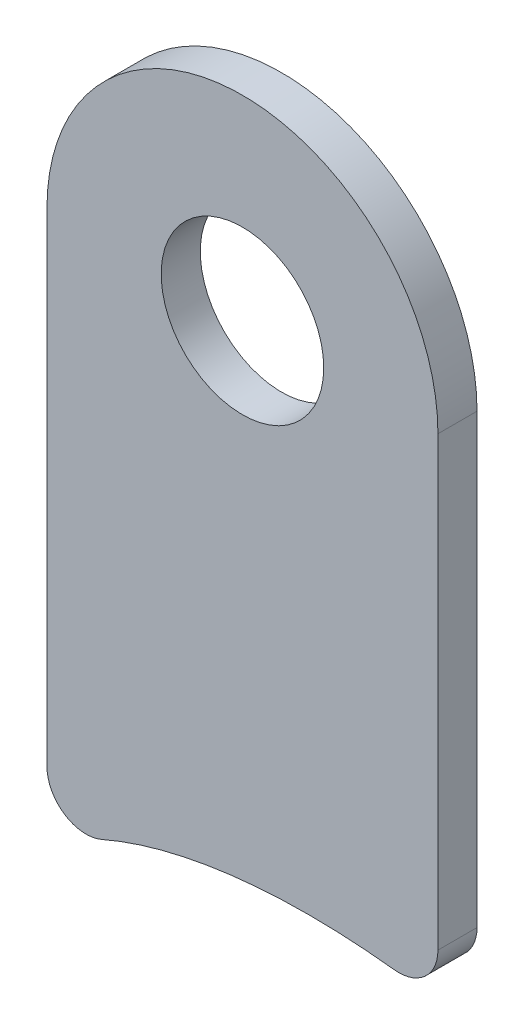
from build123d import *

# Parameters (mm, degrees)
BOSS_EXTRUDE1_DEPTH  = 1.5875
M6_CLEARANCE_HOLE1_D = 6.6
CUT_EXTRUDE3_DEPTH   = 30.699405508
FILLET2_R            = 1.5875


with BuildPart() as part:
    # Sketch1 → Boss-Extrude1 (new body)
    with BuildSketch(Plane.XY):
        with BuildLine():
            Line((7.9375, -28.575), (7.9375, 0))
            ThreePointArc((7.9375, 0), (0, 7.9375), (-7.9375, 0))
            Line((-7.9375, 0), (-7.9375, -28.575))
            Line((-7.9375, -28.575), (7.9375, -28.575))
        make_face()
    extrude(amount=BOSS_EXTRUDE1_DEPTH)

    # M6 Clearance Hole1 (through all)
    with Locations(Plane.XY.offset(1.5875)):
        with Locations((0, 0)):
            Hole(M6_CLEARANCE_HOLE1_D / 2)

    # Sketch6 → Cut-Extrude3 (cut, through all)
    with BuildSketch(Plane(origin=(0, 0, 0), x_dir=(-1, 0, 0), z_dir=(0, 0, -1))):
        with BuildLine():
            add(Edge.make_bspline(
                [(11.16362821, -26.486723611), (3.088420847, -2.404551241), (-38.374191438, -16.307748464), (-30.298984075, -40.389920834), (-22.223776712, -64.472093203), (19.238835573, -50.568895981), (11.16362821, -26.486723611)],
                knots=[0, 0, 0, 0, 0.5, 0.5, 0.5, 1, 1, 1, 1], degree=3, weights=[1, 0.333333333, 0.333333333, 1, 0.333333333, 0.333333333, 1]))
        make_face()
    extrude(amount=-CUT_EXTRUDE3_DEPTH, mode=Mode.SUBTRACT)

    # Fillet2
    fillet2_edges = [part.edges().sort_by_distance(p)[0] for p in [
        (-7.9375, -22.334180174, 0.79375),
        (7.9375, -19.980621244, 0.79375),
    ]]
    fillet(fillet2_edges, radius=FILLET2_R)


solid = part.part
